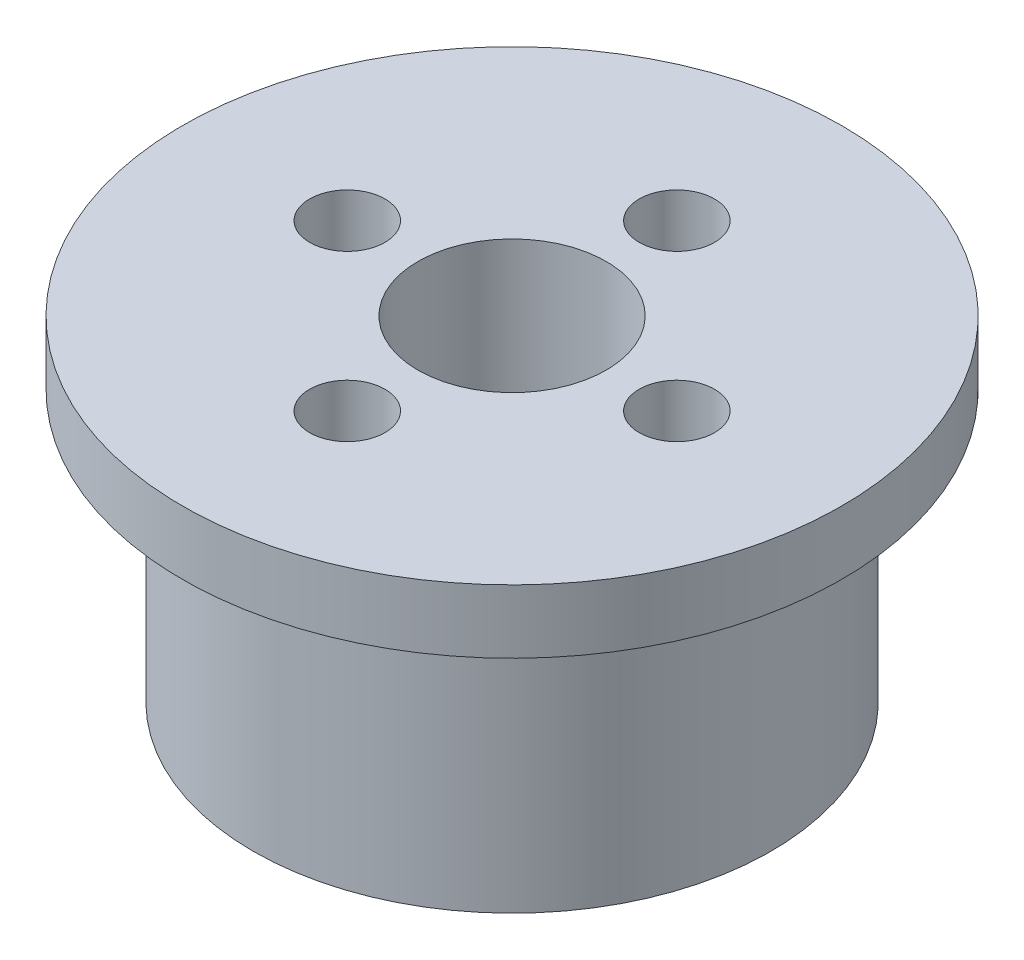
from build123d import *

# Parameters (mm, degrees)
SKETCH_3_R          = 11
EXTRUDE_1_DEPTH     = 11.5
SKETCH_4_R          = 14
EXTRUDE_2_DEPTH     = 2.7
SKETCH_5_R          = 4
SKETCH_5_R_2        = 1.6
CUT_EXTRUDE_1_DEPTH = 50


with BuildPart() as part:
    # 草图3 → 凸台-拉伸1 (new body)
    with BuildSketch(Plane(origin=(0, 0, 0), x_dir=(1, 0, 0), z_dir=(0, 1, 0))):
        Circle(SKETCH_3_R)
    extrude(amount=EXTRUDE_1_DEPTH)

    # 草图4 → 凸台-拉伸2 (add)
    with BuildSketch(Plane(origin=(0, 11.5, 0), x_dir=(1, 0, 0), z_dir=(0, 1, 0))):
        Circle(SKETCH_4_R)
    extrude(amount=EXTRUDE_2_DEPTH)

    # 草图5 → 切除-拉伸1 (cut)
    with BuildSketch(Plane(origin=(0, 14.2, 0), x_dir=(1, 0, 0), z_dir=(0, 1, 0))):
        Circle(SKETCH_5_R)
        with Locations((0, 7)):
            Circle(SKETCH_5_R_2)
        with Locations((7, 0)):
            Circle(SKETCH_5_R_2)
        with Locations((0, -7)):
            Circle(SKETCH_5_R_2)
        with Locations((-7, 0)):
            Circle(SKETCH_5_R_2)
    extrude(amount=-CUT_EXTRUDE_1_DEPTH, mode=Mode.SUBTRACT)


solid = part.part
